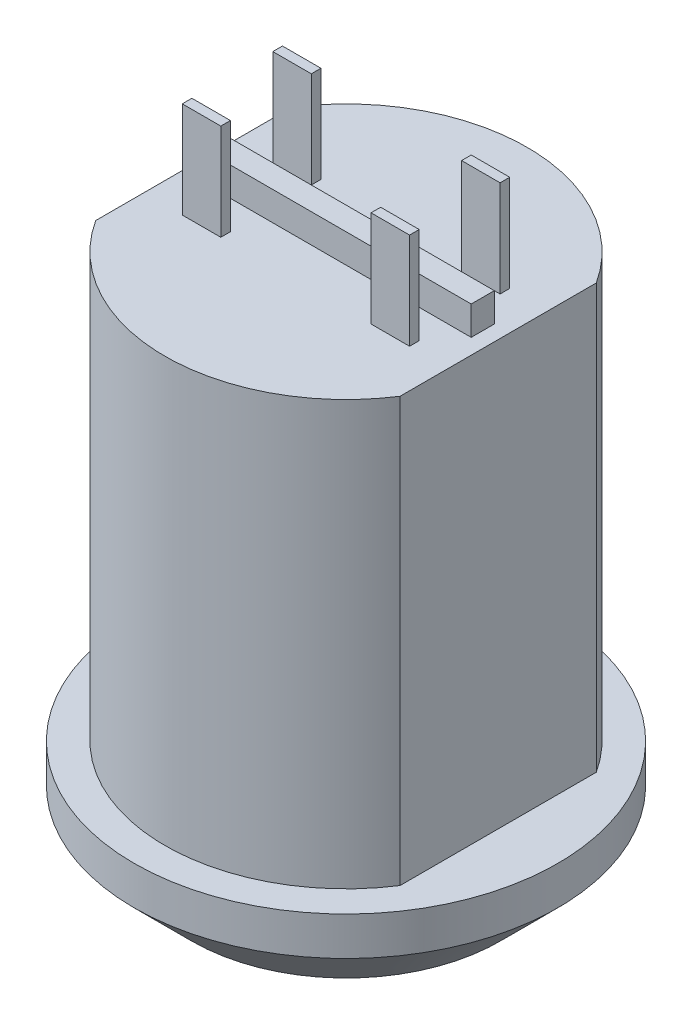
from build123d import *

# Parameters (mm, degrees)
SKETCH_1_R          = 11
EXTRUDE_1_DEPTH     = 5
CHAMFER_1_SIZE      = 3
EXTRUDE_3_DEPTH     = 22
SKETCH_4_W          = 2
SKETCH_4_H          = 7.5
CUT_EXTRUDE_1_DEPTH = 10
SKETCH_6_W          = 2
SKETCH_6_H          = 0.5
EXTRUDE_1_2_DEPTH   = 5
SKETCH_7_W          = 14.2
SKETCH_7_H          = 1.2
EXTRUDE_2_DEPTH     = 1.5


with BuildPart() as part:
    # 草图1 → Extrude 1 (new body)
    with BuildSketch(Plane(origin=(0, 0, 0), x_dir=(1, 0, 0), z_dir=(0, 1, 0))):
        Circle(SKETCH_1_R)
    extrude(amount=EXTRUDE_1_DEPTH)

    # 倒角1
    chamfer_1_edges = [part.edges().sort_by_distance(p)[0] for p in [
        (-11, 0, 0),
    ]]
    chamfer(chamfer_1_edges, length=CHAMFER_1_SIZE)

    # 草图3 → 拉伸3 (add)
    with BuildSketch(Plane(origin=(0, 5, 0), x_dir=(-1, 0, 0), z_dir=(0, 1, 0))):
        with BuildLine():
            Line((-7.9, 5.094114251), (-7.9, -5.094114251))
            ThreePointArc((-7.9, -5.094114251), (0, -9.4), (7.9, -5.094114251))
            Line((7.9, -5.094114251), (7.9, 5.094114251))
            ThreePointArc((7.9, 5.094114251), (0, 9.4), (-7.9, 5.094114251))
        make_face()
    extrude(amount=EXTRUDE_3_DEPTH)

    # 草图4 → 切除-拉伸1 (cut)
    with BuildSketch(Plane(origin=(0, 0, 0), x_dir=(-1, 0, 0), z_dir=(0, 1, 0))):
        Rectangle(SKETCH_4_W, SKETCH_4_H)
    extrude(amount=CUT_EXTRUDE_1_DEPTH, mode=Mode.SUBTRACT)

    # 草图6 → Extrude 1 2 (add)
    with BuildSketch(Plane(origin=(0, 27, 0), x_dir=(1, 0, 0), z_dir=(0, 1, 0))):
        with Locations((4.9, 2.35)):
            Rectangle(SKETCH_6_W, SKETCH_6_H)
        with Locations((-4.9, 2.35)):
            Rectangle(SKETCH_6_W, SKETCH_6_H)
        with Locations((4.9, -2.35)):
            Rectangle(SKETCH_6_W, SKETCH_6_H)
        with Locations((-4.9, -2.35)):
            Rectangle(SKETCH_6_W, SKETCH_6_H)
    extrude(amount=EXTRUDE_1_2_DEPTH)

    # 草图7 → 凸台-拉伸2 (add)
    with BuildSketch(Plane(origin=(0, 27, 0), x_dir=(1, 0, 0), z_dir=(0, 1, 0))):
        Rectangle(SKETCH_7_W, SKETCH_7_H)
    extrude(amount=EXTRUDE_2_DEPTH)


solid = part.part
